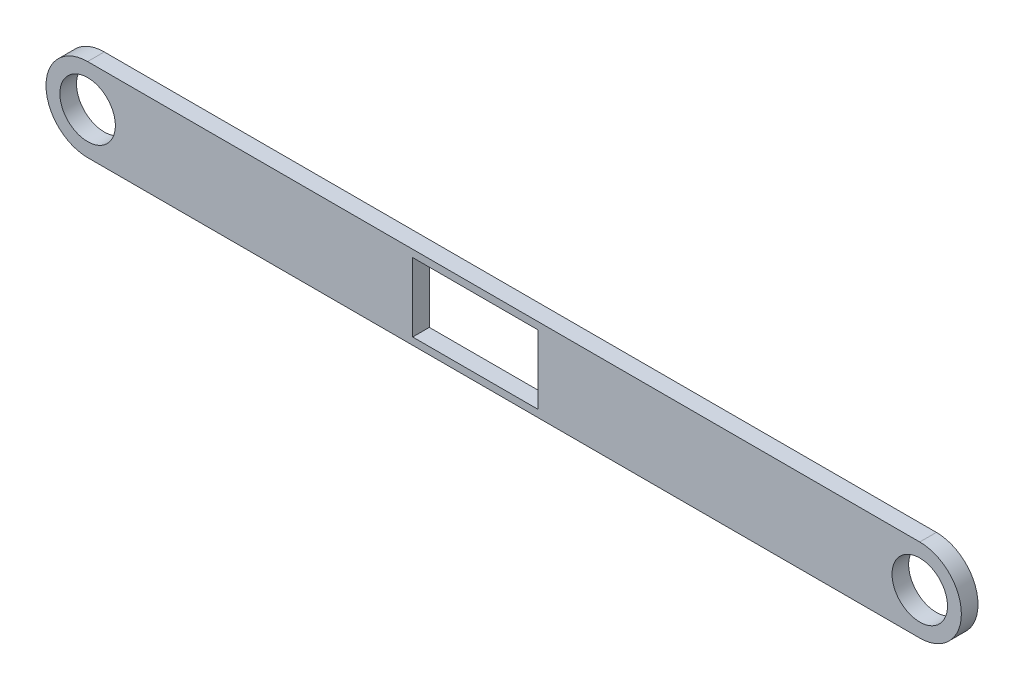
from build123d import *

# Parameters (mm, degrees)
SKETCH1_R           = 5
SKETCH1_W           = 22.6
SKETCH1_H           = 12.4
BOSS_EXTRUDE1_DEPTH = 3


with BuildPart() as part:
    # Sketch1 → Boss-Extrude1 (new body)
    with BuildSketch(Plane.XY):
        with BuildLine():
            Line((75, -7.5), (-75, -7.5))
            ThreePointArc((-75, -7.5), (-82.5, 0), (-75, 7.5))
            Line((-75, 7.5), (75, 7.5))
            ThreePointArc((75, 7.5), (82.5, 0), (75, -7.5))
        make_face()
        with Locations((75, 0)):
            Circle(SKETCH1_R, mode=Mode.SUBTRACT)
        with Locations((-75, 0)):
            Circle(SKETCH1_R, mode=Mode.SUBTRACT)
        with Locations((-5.1, 0)):
            Rectangle(SKETCH1_W, SKETCH1_H, mode=Mode.SUBTRACT)
    extrude(amount=BOSS_EXTRUDE1_DEPTH)


solid = part.part
